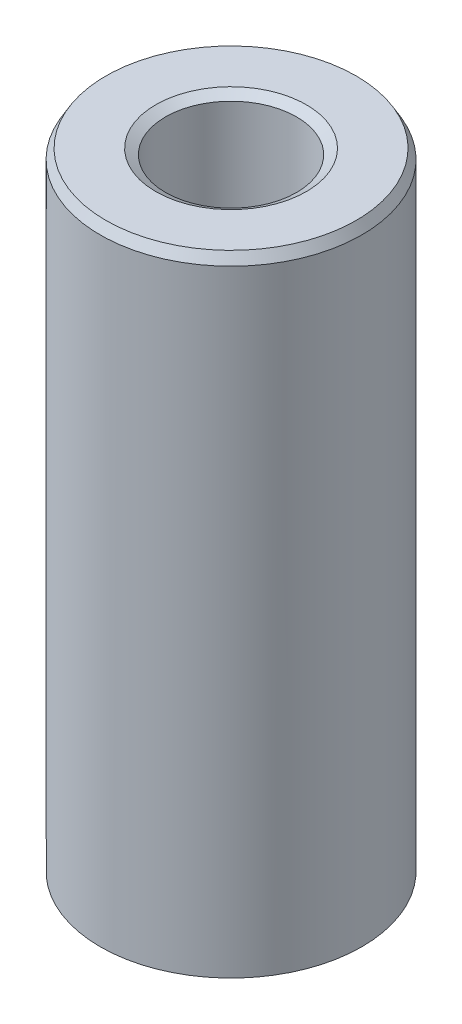
from build123d import *
from OCP.BRepFilletAPI import BRepFilletAPI_MakeChamfer

# Parameters (mm, degrees)
SKETCH1_R           = 47.5
BOSS_EXTRUDE1_DEPTH = 229.461709728
SKETCH2_R           = 23.796220924
CUT_EXTRUDE1_DEPTH  = 240.092401032
CHAMFER1_SIZE       = 3.546835391
CHAMFER1_SIZE2      = 2.047766368


with BuildPart() as part:
    # Sketch1 → Boss-Extrude1 (new body)
    with BuildSketch(Plane(origin=(0, 0, 0), x_dir=(1, 0, 0), z_dir=(0, 1, 0))):
        Circle(SKETCH1_R)
    extrude(amount=BOSS_EXTRUDE1_DEPTH)

    # Sketch2 → Cut-Extrude1 (cut, through all)
    with BuildSketch(Plane(origin=(0, 0, 0), x_dir=(1, 0, 0), z_dir=(0, 1, 0))):
        Circle(SKETCH2_R)
    extrude(amount=CUT_EXTRUDE1_DEPTH, mode=Mode.SUBTRACT)

    # Chamfer1: one chamfer whose edges measure the first distance from different faces: ONE call of the kernel's chamfer builder (chamfer() names one face for all edges)
    chamfer1_edges_1 = [part.edges().sort_by_distance(p)[0] for p in [
        (-23.796220924, 229.461709728, 0),
    ]]
    chamfer1_side_1 = [part.faces().sort_by_distance(p)[0] for p in [
        (-46.156497116, 229.461709728, 0),
    ]]
    chamfer1_edges_2 = [part.edges().sort_by_distance(p)[0] for p in [
        (-23.796220924, 0, 0),
    ]]
    chamfer1_side_2 = [part.faces().sort_by_distance(p)[0] for p in [
        (-23.796220924, 114.730854864, 0),
    ]]
    chamfer1_edges_3 = [part.edges().sort_by_distance(p)[0] for p in [
        (-47.5, 0, 0),
    ]]
    chamfer1_side_3 = [part.faces().sort_by_distance(p)[0] for p in [
        (-46.156497116, 0, 0),
    ]]
    chamfer1_edges_4 = [part.edges().sort_by_distance(p)[0] for p in [
        (-47.5, 229.461709728, 0),
    ]]
    chamfer1_side_4 = [part.faces().sort_by_distance(p)[0] for p in [
        (-47.5, 114.730854864, 0),
    ]]
    chamfer1 = BRepFilletAPI_MakeChamfer(part.part.solid().wrapped)
    for e in chamfer1_edges_1:
        chamfer1.Add(CHAMFER1_SIZE, CHAMFER1_SIZE2, e.wrapped, chamfer1_side_1[0].wrapped)  # the first distance lies on this face
    for e in chamfer1_edges_2:
        chamfer1.Add(CHAMFER1_SIZE, CHAMFER1_SIZE2, e.wrapped, chamfer1_side_2[0].wrapped)  # the first distance lies on this face
    for e in chamfer1_edges_3:
        chamfer1.Add(CHAMFER1_SIZE, CHAMFER1_SIZE2, e.wrapped, chamfer1_side_3[0].wrapped)  # the first distance lies on this face
    for e in chamfer1_edges_4:
        chamfer1.Add(CHAMFER1_SIZE, CHAMFER1_SIZE2, e.wrapped, chamfer1_side_4[0].wrapped)  # the first distance lies on this face
    add(Compound.cast(chamfer1.Shape()), mode=Mode.REPLACE)


solid = part.part
